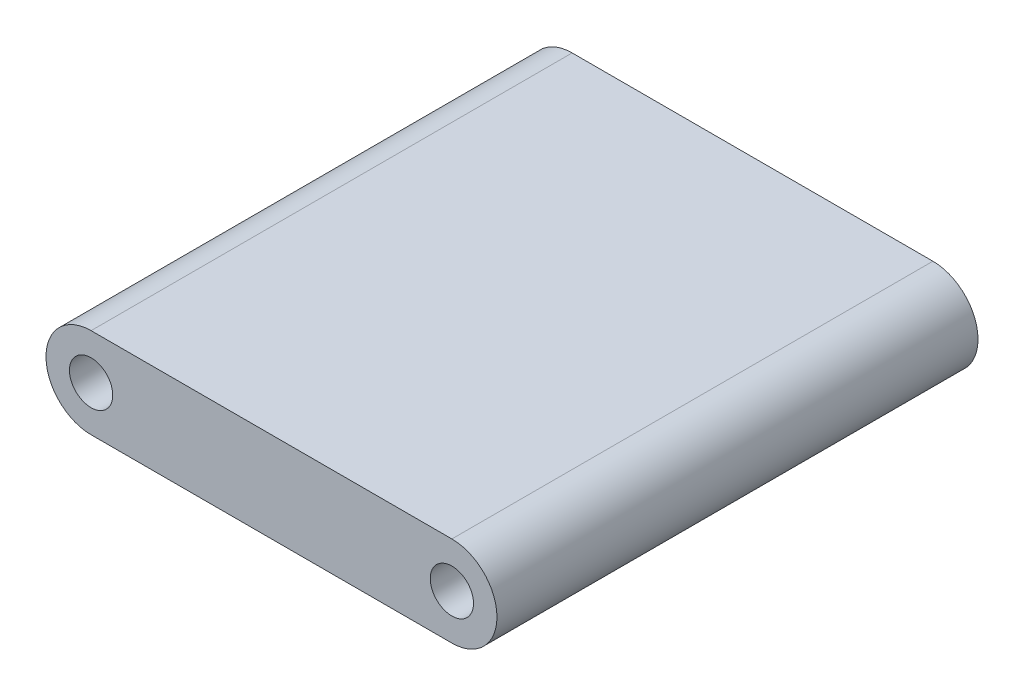
from build123d import *

# Parameters (mm, degrees)
SKETCH1_R           = 2.286
BOSS_EXTRUDE1_DEPTH = 50.8


with BuildPart() as part:
    # Sketch1 → Boss-Extrude1 (new body)
    with BuildSketch(Plane.XY):
        with BuildLine():
            Line((0, 4.7625), (38.1, 4.7625))
            ThreePointArc((38.1, 4.7625), (42.8625, 0), (38.1, -4.7625))
            Line((38.1, -4.7625), (0, -4.7625))
            ThreePointArc((0, -4.7625), (-4.7625, 0), (0, 4.7625))
        make_face()
        Circle(SKETCH1_R, mode=Mode.SUBTRACT)
        with Locations((38.1, 0)):
            Circle(SKETCH1_R, mode=Mode.SUBTRACT)
    extrude(amount=BOSS_EXTRUDE1_DEPTH)


solid = part.part
